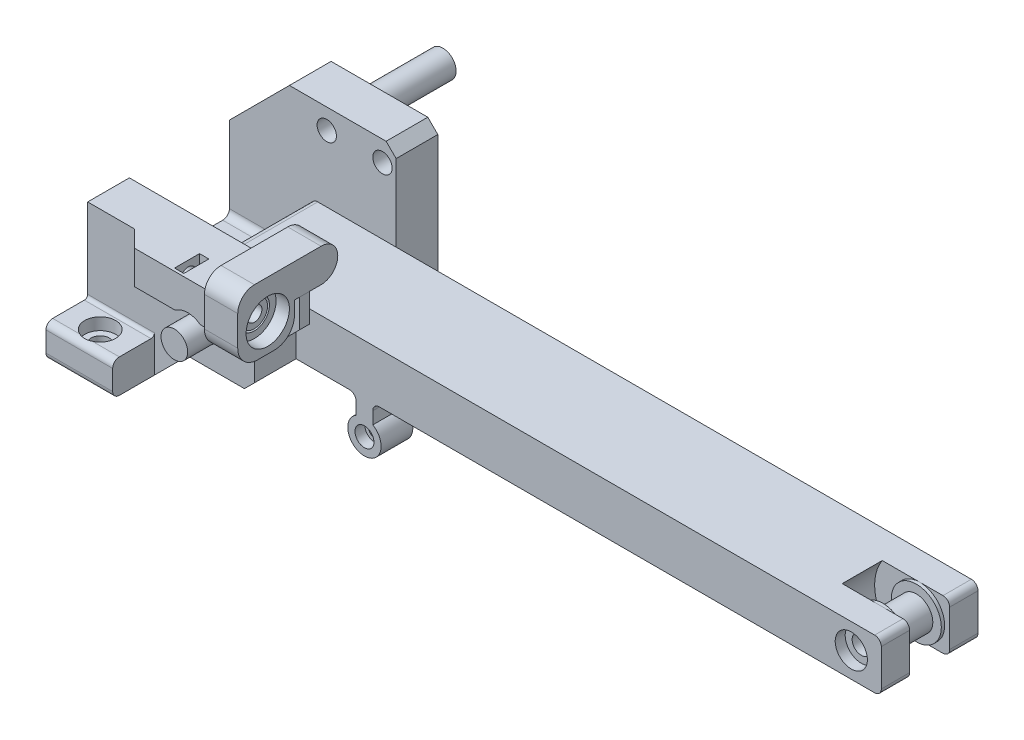
from build123d import *

# Parameters (mm, degrees)
SKETCH1_R                = 4.1
BOSS_EXTRUDE1_DEPTH      = 80
SKETCH2_W                = 30
SKETCH2_H                = 25
SKETCH2_W_2              = 12.5
CUT_EXTRUDE1_DEPTH       = 97.985823706
CUT_EXTRUDE2_DEPTH       = 91.829510623
CUT_EXTRUDE2_DEPTH_BACK  = 91.829510623
SKETCH3_R                = 2.75
SKETCH4_R                = 4.65
CUT_EXTRUDE3_DEPTH       = 3.6
BOSS_EXTRUDE2_DEPTH      = 32.5
BOSS_EXTRUDE2_DEPTH_BACK = 36.5
SKETCH5_R                = 4
SKETCH6_W                = 200
SKETCH6_H                = 15
SKETCH6_R                = 4
BOSS_EXTRUDE3_DEPTH      = 14.5
BOSS_EXTRUDE4_DEPTH      = 29
CUT_EXTRUDE4_START       = -7.5
SKETCH8_W                = 10
SKETCH8_H                = 9.330127019
CUT_EXTRUDE4_DEPTH       = 10
SKETCH9_R                = 1.75
CUT_EXTRUDE5_DEPTH       = 9.5
SKETCH10_R               = 1.75
CUT_EXTRUDE6_DEPTH       = 9.5
SKETCH12_R               = 1.75
BOSS_EXTRUDE6_DEPTH      = 12.5
SKETCH13_R               = 4
SKETCH13_R_2             = 1.75
BOSS_EXTRUDE7_DEPTH      = 22.3
SKETCH14_R               = 2.9
CUT_EXTRUDE7_DEPTH       = 10
SKETCH19_W               = 5
SKETCH19_H               = 10
BOSS_EXTRUDE8_DEPTH      = 31
CUT_EXTRUDE8_DEPTH       = 6
SKETCH16_R               = 2.25
CUT_EXTRUDE9_DEPTH       = 21
SKETCH17_R               = 4.5
BOSS_EXTRUDE10_DEPTH     = 10
SKETCH20_R               = 6.5
CUT_EXTRUDE10_DEPTH      = 4
FILLET1_R                = 6
SKETCH21_R               = 3.95
CUT_EXTRUDE11_DEPTH      = 1
BOSS_EXTRUDE11_REACH     = 203.132
SKETCH23_W               = 3
SKETCH23_H               = 12.5
BOSS_EXTRUDE12_START     = 6
SKETCH24_R               = 3.95
SKETCH24_R_2             = 2.25
BOSS_EXTRUDE12_DEPTH     = 6
SKETCH25_W               = 2.8
SKETCH25_H               = 7.5
CUT_EXTRUDE12_DEPTH      = 10
FILLET2_R                = 5
CHAMFER1_SIZE            = 4
CHAMFER2_SIZE            = 5
CHAMFER3_SIZE            = 10
CHAMFER4_SIZE            = 3
FILLET3_R                = 1
FILLET4_R                = 2
SKETCH11_R               = 13.5
CUT_EXTRUDE13_DEPTH      = 5
CUT_EXTRUDE14_START      = -29
SKETCH28_R               = 2.75
CUT_EXTRUDE14_DEPTH      = 29
CUT_EXTRUDE15_DEPTH      = 4
SKETCH31_R               = 4.825
CUT_EXTRUDE16_DEPTH      = 3
SKETCH32_R               = 13.5
SKETCH32_R_2             = 7.5
CUT_EXTRUDE17_DEPTH      = 1
CUT_EXTRUDE18_DEPTH      = 1
SKETCH35_R               = 2.5
SKETCH35_R_2             = 1.75
BOSS_EXTRUDE13_DEPTH     = 10
FILLET5_R                = 2
SKETCH36_R               = 6.25
SKETCH36_R_2             = 4.1
CUT_EXTRUDE19_DEPTH      = 5
CUT_EXTRUDE20_DEPTH      = 1
SKETCH38_R               = 2.85
CUT_EXTRUDE21_DEPTH      = 3
CUT_EXTRUDE22_DEPTH      = 2.5
SKETCH40_R               = 5.5
CUT_EXTRUDE23_DEPTH      = 6
CUT_EXTRUDE24_REACH      = 219.555
CUT_EXTRUDE24_END_RADIUS = 5.5
SKETCH41_R               = 1.75
CUT_EXTRUDE25_REACH      = 202.001
MIRROR2_START            = 31.5
MIRROR2_DEPTH            = 23


# Read off the part's stored shape, not the designer's step: Mirror2
# Some blends are built 0.0001 mm under size
with BuildPart() as part:
    # Sketch1 → Boss-Extrude1 (new body)
    with BuildSketch(Plane.XY):
        Polygon((-35, 12.5), (15, 12.5), (15, -12.5), (-15, -12.5), (-15, -22.5), (-35, -22.5), align=None)
        with Locations((0, -2.5)):
            Circle(SKETCH1_R, mode=Mode.SUBTRACT)
    extrude(amount=BOSS_EXTRUDE1_DEPTH)

    # Sketch2 → Cut-Extrude1 (cut, through all)
    with BuildSketch(Plane(origin=(15, 0, 0), x_dir=(0, 0, -1), z_dir=(1, 0, 0))):
        with Locations((-40, 0)):
            Rectangle(SKETCH2_W, SKETCH2_H)
        with Locations((-6.25, 0)):
            Rectangle(SKETCH2_W_2, SKETCH2_H)
        with Locations((-73.75, 0)):
            Rectangle(SKETCH2_W_2, SKETCH2_H)
    extrude(amount=-CUT_EXTRUDE1_DEPTH, mode=Mode.SUBTRACT)

    # Sketch3 → Cut-Extrude2 (cut, two sides: drawn at the far end of the back side and taken through both)
    with BuildSketch(Plane(origin=(0, -12.5, 0), x_dir=(1, 0, 0), z_dir=(0, 1, 0)).offset(-CUT_EXTRUDE2_DEPTH_BACK)):
        with Locations(Location((-25, -6.25, 0), (0, 0, 270))):
            Circle(SKETCH3_R)
        with Locations(Location((-25, -73.75, 0), (0, 0, 90))):
            Circle(SKETCH3_R)
        with Locations(Location((-25, -40, 0), (0, 0, 270))):
            Circle(SKETCH3_R)
    extrude(amount=CUT_EXTRUDE2_DEPTH + CUT_EXTRUDE2_DEPTH_BACK, mode=Mode.SUBTRACT)

    # Sketch4 → Cut-Extrude3 (cut)
    with BuildSketch(Plane(origin=(0, -12.5, 0), x_dir=(1, 0, 0), z_dir=(0, 1, 0))):
        with Locations(Location((-25, -6.25, 0), (0, 0, 270))):
            Circle(SKETCH4_R)
        with Locations(Location((-25, -73.75, 0), (0, 0, 270))):
            Circle(SKETCH4_R)
        with Locations(Location((-25, -40, 0), (0, 0, 270))):
            Circle(SKETCH4_R)
    extrude(amount=-CUT_EXTRUDE3_DEPTH, mode=Mode.SUBTRACT)

    # Sketch12 → Boss-Extrude6 (add)
    with BuildSketch(Plane(origin=(0, 0, 12.5), x_dir=(-1, 0, 0), z_dir=(0, 0, -1))):
        Polygon((-15, 12.5), (-15, 30.5), (17, 30.5), (35, 12.5), align=None)
        with Locations((5.8, 24.4)):
            Circle(SKETCH12_R, mode=Mode.SUBTRACT)
        with Locations((-10.9, 24.4)):
            Circle(SKETCH12_R, mode=Mode.SUBTRACT)
    extrude(amount=-BOSS_EXTRUDE6_DEPTH)

    # Sketch14 → Cut-Extrude7 (cut)
    with BuildSketch(Plane.XY.offset(25)):
        with Locations((-5.8, 24.4)):
            Circle(SKETCH14_R)
        with Locations((10.9, 24.4)):
            Circle(SKETCH14_R)
    extrude(amount=-CUT_EXTRUDE7_DEPTH, mode=Mode.SUBTRACT)

    # Sketch19 → Boss-Extrude8 (add)
    with BuildSketch(Plane(origin=(15, 0, 0), x_dir=(0, 0, -1), z_dir=(1, 0, 0))):
        with Locations((-70, 7.5)):
            Rectangle(SKETCH19_W, SKETCH19_H)
    extrude(amount=-BOSS_EXTRUDE8_DEPTH)

    # Sketch15 → Cut-Extrude8 (cut)
    with BuildSketch(Plane(origin=(15, 0, 0), x_dir=(0, 0, -1), z_dir=(1, 0, 0))):
        Polygon((-72.5, 12.5), (-55, 12.5), (-55, -2.5), (-67.5, -2.5), (-67.5, 2.5), (-72.5, 2.5), align=None)
    extrude(amount=-CUT_EXTRUDE8_DEPTH, mode=Mode.SUBTRACT)

    # Sketch16 → Cut-Extrude9 (cut)
    with BuildSketch(Plane(origin=(9, 0, 0), x_dir=(0, 0, -1), z_dir=(1, 0, 0))):
        with Locations((-67.5, 8.5)):
            Circle(SKETCH16_R)
    extrude(amount=-CUT_EXTRUDE9_DEPTH, mode=Mode.SUBTRACT)

    # Sketch21 → Cut-Extrude11 (cut)
    with BuildSketch(Plane(origin=(9, 0, 0), x_dir=(0, 0, -1), z_dir=(1, 0, 0))):
        Polygon((-72.5, 12.5), (-72.5, 2.5), (-67.5, 2.5), (-67.5, -2.5), (-55, -2.5), (-55, 12.5), align=None)
        with Locations(Location((-67.5, 8.5, 0), (0, 0, 90))):
            Circle(SKETCH21_R, mode=Mode.SUBTRACT)
    extrude(amount=-CUT_EXTRUDE11_DEPTH, mode=Mode.SUBTRACT)



with BuildPart() as body_2:
    # Sketch5 → Boss-Extrude2 (new, two sides: drawn at the far end of the back side and taken through both)
    with BuildSketch(Plane(origin=(0, 0, 40), x_dir=(-1, 0, 0), z_dir=(0, 0, -1)).offset(-BOSS_EXTRUDE2_DEPTH_BACK)):
        with Locations((0, -2.5)):
            Circle(SKETCH5_R)
    extrude(amount=BOSS_EXTRUDE2_DEPTH + BOSS_EXTRUDE2_DEPTH_BACK)


with BuildPart() as body_3:
    # Sketch6 → Boss-Extrude3 (new, symmetric)
    with BuildSketch(Plane(origin=(0, 0, 40), x_dir=(-1, 0, 0), z_dir=(0, 0, -1))):
        with Locations((-90, -2.5)):
            Rectangle(SKETCH6_W, SKETCH6_H)
        with Locations((0, -2.5)):
            Circle(SKETCH6_R, mode=Mode.SUBTRACT)
    extrude(amount=BOSS_EXTRUDE3_DEPTH, both=True)

    # Sketch7 → Boss-Extrude4 (add)
    with BuildSketch(Plane(origin=(0, 0, 25.5), x_dir=(-1, 0, 0), z_dir=(0, 0, -1))):
        with BuildLine():
            Line((-37.5, -10), (-32.5, -10))
            Line((-32.5, -10), (-32.5, -15.669872981))
            ThreePointArc((-32.5, -15.669872981), (-35, -25), (-37.5, -15.669872981))
            Line((-37.5, -15.669872981), (-37.5, -10))
        make_face()
    extrude(amount=-BOSS_EXTRUDE4_DEPTH)

    # Sketch8 → Cut-Extrude4 (cut)
    with BuildSketch(Plane(origin=(37.5, 0, 0), x_dir=(0, 0, -1), z_dir=(1, 0, 0)).offset(CUT_EXTRUDE4_START)):
        with Locations((-40, -20.33493649)):
            Rectangle(SKETCH8_W, SKETCH8_H)
    extrude(amount=CUT_EXTRUDE4_DEPTH, mode=Mode.SUBTRACT)

    # Sketch9 → Cut-Extrude5 (cut)
    with BuildSketch(Plane(origin=(0, 0, 25.5), x_dir=(-1, 0, 0), z_dir=(0, 0, -1))):
        with Locations((-35, -20)):
            Circle(SKETCH9_R)
    extrude(amount=-CUT_EXTRUDE5_DEPTH, mode=Mode.SUBTRACT)

    # Sketch10 → Cut-Extrude6 (cut)
    with BuildSketch(Plane.XY.offset(54.5)):
        with Locations(Location((35, -20, 0), (0, 0, 180))):
            Circle(SKETCH10_R)
    extrude(amount=-CUT_EXTRUDE6_DEPTH, mode=Mode.SUBTRACT)

    # Sketch11 → Cut-Extrude13 (cut, symmetric)
    with BuildSketch(Plane.XY.offset(40)):
        with Locations((181, -2.5)):
            Circle(SKETCH11_R)
    extrude(amount=CUT_EXTRUDE13_DEPTH, both=True, mode=Mode.SUBTRACT)

    # Sketch28 → Cut-Extrude14 (cut)
    with BuildSketch(Plane.XY.offset(54.5).offset(CUT_EXTRUDE14_START)):
        with Locations((181, -2.5)):
            Circle(SKETCH28_R)
    extrude(amount=CUT_EXTRUDE14_DEPTH, mode=Mode.SUBTRACT)

    # Sketch30 → Cut-Extrude15 (cut)
    with BuildSketch(Plane(origin=(0, 0, 25.5), x_dir=(-1, 0, 0), z_dir=(0, 0, -1))):
        Polygon((-181, 2.147669667), (-185.025, -0.176165167), (-185.025, -4.823834833), (-181, -7.147669667), (-176.975, -4.823834833), (-176.975, -0.176165167), align=None)
    extrude(amount=-CUT_EXTRUDE15_DEPTH, mode=Mode.SUBTRACT)

    # Sketch31 → Cut-Extrude16 (cut)
    with BuildSketch(Plane.XY.offset(54.5)):
        with Locations((181, -2.5)):
            Circle(SKETCH31_R)
    extrude(amount=-CUT_EXTRUDE16_DEPTH, mode=Mode.SUBTRACT)

    # Sketch32 → Cut-Extrude17 (cut)
    with BuildSketch(Plane(origin=(0, 0, 45), x_dir=(-1, 0, 0), z_dir=(0, 0, -1))):
        with Locations((-181, -2.5)):
            Circle(SKETCH32_R)
        with Locations(Location((-181, -2.5, 0), (0, 0, 270))):
            Circle(SKETCH32_R_2, mode=Mode.SUBTRACT)
    extrude(amount=-CUT_EXTRUDE17_DEPTH, mode=Mode.SUBTRACT)

    # Sketch33 → Cut-Extrude18 (cut)
    with BuildSketch(Plane.XY.offset(35)):
        with BuildLine():
            Line((169.77502784, -10), (190, -10))
            Line((190, -10), (190, 5))
            Line((190, 5), (169.77502784, 5))
            ThreePointArc((169.77502784, 5), (167.5, -2.5), (169.77502784, -10))
        make_face()
    extrude(amount=-CUT_EXTRUDE18_DEPTH, mode=Mode.SUBTRACT)

    # Fillet5
    fillet5_edges = [body_3.edges().sort_by_distance(p)[0] for p in [
        (190, -10, 50.25),
        (190, 5, 50.25),
        (37.5, -10, 40),
        (32.5, -10, 40),
        (37.5, -15.669872981, 40),
        (32.5, -15.669872981, 40),
        (190, 5, 29.75),
        (-10, 5, 40),
        (-10, -10, 40),
        (190, -10, 29.75),
    ]]
    fillet(fillet5_edges, radius=FILLET5_R)

    # Sketch38 → Cut-Extrude21 (cut)
    with BuildSketch(Plane.XY.offset(54.5)):
        with Locations((35, -20)):
            Circle(SKETCH38_R)
    extrude(amount=-CUT_EXTRUDE21_DEPTH, mode=Mode.SUBTRACT)

    # Sketch39 → Cut-Extrude22 (cut)
    with BuildSketch(Plane(origin=(0, 0, 25.5), x_dir=(-1, 0, 0), z_dir=(0, 0, -1))):
        Polygon((-35, -16.709103466), (-37.85, -18.354551733), (-37.85, -21.645448267), (-35, -23.290896534), (-32.15, -21.645448267), (-32.15, -18.354551733), align=None)
    extrude(amount=-CUT_EXTRUDE22_DEPTH, mode=Mode.SUBTRACT)

    # Sketch40 → Cut-Extrude23 (cut)
    with BuildSketch(Plane(origin=(0, 0, 25.5), x_dir=(-1, 0, 0), z_dir=(0, 0, -1))):
        with Locations((0, -2.5)):
            Circle(SKETCH40_R)
    cut_extrude23 = extrude(amount=-CUT_EXTRUDE23_DEPTH, mode=Mode.SUBTRACT)

    # Mirror1: Cut-Extrude23 across plane
    add(cut_extrude23.mirror(Plane(origin=(0, 0, 40), x_dir=(1, 0, 0), z_dir=(0, 0, -1))), mode=Mode.SUBTRACT)

    # Cut-Extrude24: up to this cylinder (the profile starts outside it)
    cut_extrude24_end = Plane(origin=(0, -2.5, 40), z_dir=(0, 0, -1)) * Cylinder(CUT_EXTRUDE24_END_RADIUS, 473.11, mode=Mode.PRIVATE)
    # Sketch41 → Cut-Extrude24 (cut, up to the surface)
    with BuildSketch(Plane.ZY.offset(10), mode=Mode.PRIVATE) as cut_extrude24_sk1:
        with Locations(Location((29, -2.5, 0), (0, 0, 270))):
            Circle(SKETCH41_R)
    cut_extrude24_tool1 = extrude(cut_extrude24_sk1.sketch, amount=-CUT_EXTRUDE24_REACH, mode=Mode.PRIVATE) - cut_extrude24_end
    add(cut_extrude24_tool1.solids().sort_by_distance((-10, -2.5, 29))[0], mode=Mode.SUBTRACT)
    # Sketch41 → Cut-Extrude24 (cut, up to the surface)
    with BuildSketch(Plane.ZY.offset(10), mode=Mode.PRIVATE) as cut_extrude24_sk2:
        with Locations(Location((51, -2.5, 0), (0, 0, 270))):
            Circle(SKETCH41_R)
    cut_extrude24_tool2 = extrude(cut_extrude24_sk2.sketch, amount=-CUT_EXTRUDE24_REACH, mode=Mode.PRIVATE) - cut_extrude24_end
    add(cut_extrude24_tool2.solids().sort_by_distance((-10, -2.5, 51))[0], mode=Mode.SUBTRACT)

    # Cut-Extrude25: up to this face of the body (flat: up to its plane)
    cut_extrude25_end = Plane(body_3.part.faces().sort_by_distance((5.344436508, -2.5, 31.5))[0])
    # Sketch42 → Cut-Extrude25 (cut, up to the picked face)
    with BuildSketch(Plane(origin=(0, 0, 25.5), x_dir=(-1, 0, 0), z_dir=(0, 0, -1)), mode=Mode.PRIVATE) as cut_extrude25_sk1:
        with BuildLine():
            Line((5.123475383, -0.5), (6.623475383, -0.5))
            Line((6.623475383, -0.5), (6.623475383, -4.5))
            Line((6.623475383, -4.5), (5.123475383, -4.5))
            ThreePointArc((5.123475383, -4.5), (5.5, -2.5), (5.123475383, -0.5))
        make_face()
    cut_extrude25_tool1 = split(extrude(cut_extrude25_sk1.sketch, amount=-CUT_EXTRUDE25_REACH, mode=Mode.PRIVATE), bisect_by=cut_extrude25_end, keep=Keep.BOTH, mode=Mode.PRIVATE)
    add(cut_extrude25_tool1.solids().sort_by(Axis((-5.994869, -2.5, 25.5), (0, 0, 1)))[0], mode=Mode.SUBTRACT)

    # Mirror2 outline → Mirror2 (cut)
    with BuildSketch(Plane.XY.offset(MIRROR2_START)):
        with BuildLine():
            Line((-5.123475383, -0.5), (-6.623475383, -0.5))
            Line((-6.623475383, -0.5), (-6.623475383, -4.5))
            Line((-6.623475383, -4.5), (-5.123475383, -4.5))
            ThreePointArc((-5.123475383, -4.5), (-5.5, -2.5), (-5.123475383, -0.5))
        make_face()
    extrude(amount=MIRROR2_DEPTH, mode=Mode.SUBTRACT)


with BuildPart() as body_4:
    # Sketch13 → Boss-Extrude7 (new body)
    with BuildSketch(Plane(origin=(0, 0, 12.5), x_dir=(-1, 0, 0), z_dir=(0, 0, -1))):
        with Locations((5.8, 24.4)):
            Circle(SKETCH13_R)
        with Locations((5.8, 24.4)):
            Circle(SKETCH13_R_2, mode=Mode.SUBTRACT)
    extrude(amount=BOSS_EXTRUDE7_DEPTH)


with BuildPart() as body_5:
    # Sketch17 → Boss-Extrude10 (new body)
    with BuildSketch(Plane(origin=(9, 0, 0), x_dir=(0, 0, -1), z_dir=(1, 0, 0))):
        Polygon((-46.5, 20), (-76.5, 20), (-76.5, 0), (-59.5, 0), (-59.5, 10), (-46.5, 10), align=None)
        with Locations(Location((-67.5, 8.5, 0), (0, 0, 90))):
            Circle(SKETCH17_R, mode=Mode.SUBTRACT)
    extrude(amount=BOSS_EXTRUDE10_DEPTH)

    # Sketch20 → Cut-Extrude10 (cut)
    with BuildSketch(Plane.ZY.offset(-19)):
        with Locations(Location((67.5, 8.5, 0), (0, 0, 270))):
            Circle(SKETCH20_R)
    extrude(amount=CUT_EXTRUDE10_DEPTH, mode=Mode.SUBTRACT)

    # Fillet1
    fillet1_edges = [body_5.edges().sort_by_distance(p)[0] for p in [
        (14, 0, 59.5),
        (14, 0, 76.5),
    ]]
    fillet(fillet1_edges, radius=FILLET1_R)


with BuildPart() as part_1:
    add(part.part)

    # Boss-Extrude11: up to this face of the body (flat: up to its plane)
    boss_extrude11_end = Plane(body_5.part.faces().sort_by_distance((19, 13.054237851, 62.146867645))[0])
    # Sketch23 → Boss-Extrude11 (add, up to the picked face)
    with BuildSketch(Plane(origin=(8, 0, 0), x_dir=(0, 0, -1), z_dir=(1, 0, 0)), mode=Mode.PRIVATE) as boss_extrude11_sk1:
        with Locations((-56.5, 3.75)):
            Rectangle(SKETCH23_W, SKETCH23_H)
    boss_extrude11_tool1 = split(extrude(boss_extrude11_sk1.sketch, amount=BOSS_EXTRUDE11_REACH, mode=Mode.PRIVATE), bisect_by=boss_extrude11_end, keep=Keep.BOTH, mode=Mode.PRIVATE)
    add(boss_extrude11_tool1.solids().sort_by(Axis((8, 3.75, 56.5), (1, 0, 0)))[0])

    # Sketch24 → Boss-Extrude12 (add)
    with BuildSketch(Plane(origin=(9, 0, 0), x_dir=(0, 0, -1), z_dir=(1, 0, 0)).offset(BOSS_EXTRUDE12_START)):
        with Locations(Location((-67.5, 8.5, 0), (0, 0, 90))):
            Circle(SKETCH24_R)
        with Locations((-67.5, 8.5)):
            Circle(SKETCH24_R_2, mode=Mode.SUBTRACT)
    extrude(amount=-BOSS_EXTRUDE12_DEPTH)

    # Sketch25 → Cut-Extrude12 (cut)
    with BuildSketch(Plane(origin=(0, 12.5, 0), x_dir=(1, 0, 0), z_dir=(0, 1, 0))):
        with Locations((-3.4, -67.90401604)):
            Rectangle(SKETCH25_W, SKETCH25_H)
    extrude(amount=-CUT_EXTRUDE12_DEPTH, mode=Mode.SUBTRACT)

    # Chamfer1
    chamfer1_edges = [part_1.edges().sort_by_distance(p)[0] for p in [
        (19, -2.5, 56.5),
    ]]
    chamfer(chamfer1_edges, length=CHAMFER1_SIZE - 0.0001)  # a hair under: the kernel refuses the full size

    # Chamfer2
    chamfer2_edges = [part_1.edges().sort_by_distance(p)[0] for p in [
        (-16, 7.5, 67.5),
    ]]
    chamfer(chamfer2_edges, length=CHAMFER2_SIZE - 0.0001)  # a hair under: the kernel refuses the full size

    # Chamfer3
    chamfer3_edges = [part_1.edges().sort_by_distance(p)[0] for p in [
        (-15, -12.5, 61.25),
        (-15, -12.5, 18.75),
    ]]
    chamfer(chamfer3_edges, length=CHAMFER3_SIZE - 0.0001)  # a hair under: the kernel refuses the full size

    # Chamfer4
    chamfer4_edges = [part_1.edges().sort_by_distance(p)[0] for p in [
        (15, 30.5, 18.75),
        (15, -12.5, 61.25),
        (15, -12.5, 18.75),
    ]]
    chamfer(chamfer4_edges, length=CHAMFER4_SIZE)

    # Fillet3
    fillet3_edges = [part_1.edges().sort_by_distance(p)[0] for p in [
        (-25, -12.5, 12.5),
        (-25, -12.5, 67.5),
    ]]
    fillet(fillet3_edges, radius=FILLET3_R)

    # Fillet4
    # the kernel refuses this fillet: 2 mm, written as the material it adds along each edge
    with BuildSketch(Plane(origin=(-15, -12.5, 25), x_dir=(0, 0, 1), z_dir=(-1, 0, 0)), Plane(origin=(-15, -12.5, 55), x_dir=(0, 1, 0), z_dir=(-1, 0, 0))) as fillet4_piece_1:
        with BuildLine():
            CenterArc((FILLET4_R, FILLET4_R), FILLET4_R, 180, 90)
            Line((0, FILLET4_R), (0, 0))
            Line((0, 0), (FILLET4_R, 0))
        make_face()
    extrude(amount=20)
    # the kernel refuses this fillet: 2 mm, written as the material it takes off along each edge
    with BuildSketch(Plane(origin=(-10, -22.5, 80), x_dir=(0, 0, -1), z_dir=(-1, 0, 0)), Plane(origin=(-10, -12.5, 0), x_dir=(0, 0, 1), z_dir=(-1, 0, 0)), Plane(origin=(-10, -12.5, 80), x_dir=(0, -1, 0), z_dir=(-1, 0, 0)), Plane(origin=(-10, -22.5, 0), x_dir=(0, 1, 0), z_dir=(-1, 0, 0))) as fillet4_2_piece_1:
        with BuildLine():
            CenterArc((FILLET4_R, -FILLET4_R), FILLET4_R, 90, 90)
            Line((0, -FILLET4_R), (0, 0))
            Line((0, 0), (FILLET4_R, 0))
        make_face()
    extrude(amount=30, mode=Mode.SUBTRACT)

    # Sketch36 → Cut-Extrude19 (cut)
    with BuildSketch(Plane.XY.offset(67.5)):
        with Locations((0, -2.5)):
            Circle(SKETCH36_R)
        with Locations(Location((0, -2.5, 0), (0, 0, 180))):
            Circle(SKETCH36_R_2, mode=Mode.SUBTRACT)
    extrude(amount=CUT_EXTRUDE19_DEPTH, mode=Mode.SUBTRACT)

    # Sketch37 → Cut-Extrude20 (cut)
    with BuildSketch(Plane(origin=(-15, 0, 0), x_dir=(0, 0, -1), z_dir=(1, 0, 0))):
        with BuildLine():
            Line((-55, -22.5), (-25, -22.5))
            Line((-25, -22.5), (-25, -10.5))
            ThreePointArc((-25, -10.5), (-25.585786438, -11.914213562), (-27, -12.5))
            Line((-27, -12.5), (-53, -12.5))
            ThreePointArc((-53, -12.5), (-54.414213562, -11.914213562), (-55, -10.5))
            Line((-55, -10.5), (-55, -22.5))
        make_face()
    extrude(amount=-CUT_EXTRUDE20_DEPTH, mode=Mode.SUBTRACT)


with BuildPart() as body_5_1:
    add(body_5.part)

    # Fillet2
    fillet2_edges = [body_5_1.edges().sort_by_distance(p)[0] for p in [
        (14, 10, 46.5),
        (14, 20, 46.5),
        (14, 20, 76.5),
    ]]
    fillet(fillet2_edges, radius=FILLET2_R - 0.0001)  # a hair under: the kernel refuses the full size


with BuildPart() as body_6:
    # Sketch34 → Revolve1 (revolve)
    with BuildSketch(Plane(origin=(0, -2.5, 0), x_dir=(1, 0, 0), z_dir=(0, 1, 0)), mode=Mode.PRIVATE) as revolve1_sk:
        Polygon((178.25, -44.6), (176.05, -44.6), (176.05, -35), (173.5, -35), (173.5, -34), (178.25, -34), align=None)
    revolve(revolve1_sk.sketch.rotate(Axis((181, -2.5, 45), (0, 0, -1)), 180), axis=Axis((181, -2.5, 45), (0, 0, -1)))


with BuildPart() as body_7:
    # Sketch35 → Boss-Extrude13 (new body)
    with BuildSketch(Plane(origin=(0, 0, 45), x_dir=(-1, 0, 0), z_dir=(0, 0, -1))):
        with Locations(Location((-35, -20, 0), (0, 0, 270))):
            Circle(SKETCH35_R)
        with Locations(Location((-35, -20, 0), (0, 0, 270))):
            Circle(SKETCH35_R_2, mode=Mode.SUBTRACT)
    extrude(amount=BOSS_EXTRUDE13_DEPTH)


solid = Compound([body_2.part, body_3.part, body_4.part, part_1.part, body_5_1.part, body_6.part, body_7.part])
